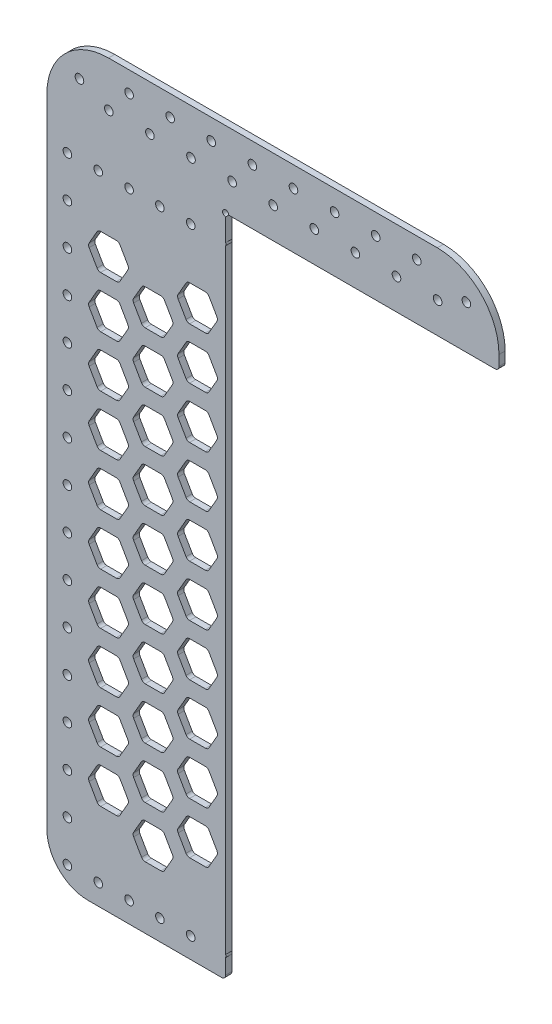
from build123d import *

# Parameters (mm, degrees)
SKETCH1_W           = 110
SKETCH1_H           = 320
BOSS_EXTRUDE1_DEPTH = 3
BOSS_EXTRUDE2_DEPTH = 3
SKETCH3_W           = 20
SKETCH3_H           = 55
SKETCH3_W_2         = 60
SKETCH3_H_2         = 190
CUT_EXTRUDE1_DEPTH  = 260.295198567
CUT_EXTRUDE2_DEPTH  = 260.295198567
FILLET1_R           = 2
FILL_PATTERN2_DEPTH = 3
SKETCH6_R           = 2.1
CUT_EXTRUDE3_DEPTH  = 260.295198567
SKETCH8_R           = 1
CUT_EXTRUDE4_DEPTH  = 260.295198567
FILLET2_R           = 5
FILLET3_R           = 10
FILLET4_R           = 20
SKETCH9_R           = 2.1
CUT_EXTRUDE5_DEPTH  = 260.295198567
SKETCH10_R          = 2.1
CUT_EXTRUDE6_DEPTH  = 260.295198567
SKETCH11_R          = 2.1
CUT_EXTRUDE7_DEPTH  = 260.295198567
SKETCH12_W          = 133
SKETCH12_H          = 323
CUT_EXTRUDE13_DEPTH = 10
SKETCH13_R          = 2.1
BOSS_EXTRUDE3_DEPTH = 3
FILLET5_R           = 2
SKETCH14_R          = 1.5
CUT_EXTRUDE14_DEPTH = 260.295198567
SKETCH15_R          = 2.1
CUT_EXTRUDE15_DEPTH = 260.295198567


# Read off the part's stored shape, not the designer's step: Fill Pattern2
with BuildPart() as part:
    # Sketch1 → Boss-Extrude1 (new body)
    with BuildSketch(Plane.XY):
        Rectangle(SKETCH1_W, SKETCH1_H)
    extrude(amount=BOSS_EXTRUDE1_DEPTH)

    # Sketch2 → Boss-Extrude2 (add)
    with BuildSketch(Plane.XY.offset(3)):
        with BuildLine():
            Line((-55, 160), (-55, 170))
            ThreePointArc((-55, 170), (-46.213203436, 191.213203436), (-25, 200))
            Line((-25, 200), (135, 200))
            ThreePointArc((135, 200), (156.213203436, 191.213203436), (165, 170))
            Line((165, 170), (165, -45))
            Line((165, -45), (55, -160))
            Line((55, -160), (55, 160))
            Line((55, 160), (-55, 160))
        make_face()
    extrude(amount=-BOSS_EXTRUDE2_DEPTH)

    # Sketch3 → Cut-Extrude1 (cut, through all)
    with BuildSketch(Plane.XY.offset(3)):
        with Locations((45, 72.508427125)):
            Rectangle(SKETCH3_W, SKETCH3_H)
        with Locations((100, 66.131519895)):
            Rectangle(SKETCH3_W_2, SKETCH3_H_2)
    extrude(amount=-CUT_EXTRUDE1_DEPTH, mode=Mode.SUBTRACT)

    # Sketch5 → Cut-Extrude2 (cut, through all)
    with BuildSketch(Plane.XY.offset(3)):
        Polygon((-20, 125), (-30, 125), (-35, 116.339745962), (-30, 107.679491924), (-20, 107.679491924), (-15, 116.339745962), align=None)
    extrude(amount=-CUT_EXTRUDE2_DEPTH, mode=Mode.SUBTRACT)

    # Fillet1
    fillet1_edges = [part.edges().sort_by_distance(p)[0] for p in [
        (-20, 125, 1.5),
        (-15, 116.339745962, 1.5),
        (-20, 107.679491924, 1.5),
        (-30, 107.679491924, 1.5),
        (-35, 116.339745962, 1.5),
        (-30, 125, 1.5),
    ]]
    fillet(fillet1_edges, radius=FILLET1_R)

    # Fill Pattern2 outline → Fill Pattern2 (cut)
    with BuildSketch(Plane.XY):
        with BuildLine():
            ThreePointArc((6.073284825, 77.839745962), (6.341234018, 78.839745962), (6.073284825, 79.839745962))
            Line((6.073284825, 79.839745962), (2.227985364, 86.5))
            ThreePointArc((2.227985364, 86.5), (1.495934556, 87.232050808), (0.495934556, 87.5))
            Line((0.495934556, 87.5), (-7.194664367, 87.5))
            ThreePointArc((-7.194664367, 87.5), (-8.194664367, 87.232050808), (-8.926715175, 86.5))
            Line((-8.926715175, 86.5), (-12.772014636, 79.839745962))
            ThreePointArc((-12.772014636, 79.839745962), (-13.039963829, 78.839745962), (-12.772014636, 77.839745962))
            Line((-12.772014636, 77.839745962), (-8.926715175, 71.179491924))
            ThreePointArc((-8.926715175, 71.179491924), (-8.194664367, 70.447441117), (-7.194664367, 70.179491924))
            Line((-7.194664367, 70.179491924), (0.495934556, 70.179491924))
            ThreePointArc((0.495934556, 70.179491924), (1.495934556, 70.447441117), (2.227985364, 71.179491924))
            Line((2.227985364, 71.179491924), (6.073284825, 77.839745962))
        make_face()
        with BuildLine():
            ThreePointArc((27.72391992, 40.339745962), (27.991869112, 41.339745962), (27.72391992, 42.339745962))
            Line((27.72391992, 42.339745962), (23.878620458, 49))
            ThreePointArc((23.878620458, 49), (23.146569651, 49.732050808), (22.146569651, 50))
            Line((22.146569651, 50), (14.455970728, 50))
            ThreePointArc((14.455970728, 50), (13.455970728, 49.732050808), (12.72391992, 49))
            Line((12.72391992, 49), (8.878620458, 42.339745962))
            ThreePointArc((8.878620458, 42.339745962), (8.610671266, 41.339745962), (8.878620458, 40.339745962))
            Line((8.878620458, 40.339745962), (12.72391992, 33.679491924))
            ThreePointArc((12.72391992, 33.679491924), (13.455970728, 32.947441117), (14.455970728, 32.679491924))
            Line((14.455970728, 32.679491924), (22.146569651, 32.679491924))
            ThreePointArc((22.146569651, 32.679491924), (23.146569651, 32.947441117), (23.878620458, 33.679491924))
            Line((23.878620458, 33.679491924), (27.72391992, 40.339745962))
        make_face()
        with BuildLine():
            ThreePointArc((12.72391992, 108.679491924), (13.455970728, 107.947441117), (14.455970728, 107.679491924))
            Line((14.455970728, 107.679491924), (22.146569651, 107.679491924))
            ThreePointArc((22.146569651, 107.679491924), (23.146569651, 107.947441117), (23.878620458, 108.679491924))
            Line((23.878620458, 108.679491924), (27.72391992, 115.339745962))
            ThreePointArc((27.72391992, 115.339745962), (27.991869112, 116.339745962), (27.72391992, 117.339745962))
            Line((27.72391992, 117.339745962), (23.878620458, 124))
            ThreePointArc((23.878620458, 124), (23.146569651, 124.732050808), (22.146569651, 125))
            Line((22.146569651, 125), (14.455970728, 125))
            ThreePointArc((14.455970728, 125), (13.455970728, 124.732050808), (12.72391992, 124))
            Line((12.72391992, 124), (8.878620458, 117.339745962))
            ThreePointArc((8.878620458, 117.339745962), (8.610671266, 116.339745962), (8.878620458, 115.339745962))
            Line((8.878620458, 115.339745962), (12.72391992, 108.679491924))
        make_face()
        with BuildLine():
            ThreePointArc((-21.154700538, 32.679491924), (-20.154700538, 32.947441117), (-19.422649731, 33.679491924))
            Line((-19.422649731, 33.679491924), (-15.577350269, 40.339745962))
            ThreePointArc((-15.577350269, 40.339745962), (-15.309401077, 41.339745962), (-15.577350269, 42.339745962))
            Line((-15.577350269, 42.339745962), (-19.422649731, 49))
            ThreePointArc((-19.422649731, 49), (-20.154700538, 49.732050808), (-21.154700538, 50))
            Line((-21.154700538, 50), (-28.845299462, 50))
            ThreePointArc((-28.845299462, 50), (-29.845299462, 49.732050808), (-30.577350269, 49))
            Line((-30.577350269, 49), (-34.422649731, 42.339745962))
            ThreePointArc((-34.422649731, 42.339745962), (-34.690598923, 41.339745962), (-34.422649731, 40.339745962))
            Line((-34.422649731, 40.339745962), (-30.577350269, 33.679491924))
            ThreePointArc((-30.577350269, 33.679491924), (-29.845299462, 32.947441117), (-28.845299462, 32.679491924))
            Line((-28.845299462, 32.679491924), (-21.154700538, 32.679491924))
        make_face()
        with BuildLine():
            ThreePointArc((27.72391992, -59.660254038), (27.991869112, -58.660254038), (27.72391992, -57.660254038))
            Line((27.72391992, -57.660254038), (23.878620458, -51))
            ThreePointArc((23.878620458, -51), (23.146569651, -50.267949192), (22.146569651, -50))
            Line((22.146569651, -50), (14.455970728, -50))
            ThreePointArc((14.455970728, -50), (13.455970728, -50.267949192), (12.72391992, -51))
            Line((12.72391992, -51), (8.878620458, -57.660254038))
            ThreePointArc((8.878620458, -57.660254038), (8.610671266, -58.660254038), (8.878620458, -59.660254038))
            Line((8.878620458, -59.660254038), (12.72391992, -66.320508076))
            ThreePointArc((12.72391992, -66.320508076), (13.455970728, -67.052558883), (14.455970728, -67.320508076))
            Line((14.455970728, -67.320508076), (22.146569651, -67.320508076))
            ThreePointArc((22.146569651, -67.320508076), (23.146569651, -67.052558883), (23.878620458, -66.320508076))
            Line((23.878620458, -66.320508076), (27.72391992, -59.660254038))
        make_face()
        with BuildLine():
            ThreePointArc((6.073284825, -22.160254038), (6.341234018, -21.160254038), (6.073284825, -20.160254038))
            Line((6.073284825, -20.160254038), (2.227985364, -13.5))
            ThreePointArc((2.227985364, -13.5), (1.495934556, -12.767949192), (0.495934556, -12.5))
            Line((0.495934556, -12.5), (-7.194664367, -12.5))
            ThreePointArc((-7.194664367, -12.5), (-8.194664367, -12.767949192), (-8.926715175, -13.5))
            Line((-8.926715175, -13.5), (-12.772014636, -20.160254038))
            ThreePointArc((-12.772014636, -20.160254038), (-13.039963829, -21.160254038), (-12.772014636, -22.160254038))
            Line((-12.772014636, -22.160254038), (-8.926715175, -28.820508076))
            ThreePointArc((-8.926715175, -28.820508076), (-8.194664367, -29.552558883), (-7.194664367, -29.820508076))
            Line((-7.194664367, -29.820508076), (0.495934556, -29.820508076))
            ThreePointArc((0.495934556, -29.820508076), (1.495934556, -29.552558883), (2.227985364, -28.820508076))
            Line((2.227985364, -28.820508076), (6.073284825, -22.160254038))
        make_face()
        with BuildLine():
            ThreePointArc((-15.577350269, 15.339745962), (-15.309401077, 16.339745962), (-15.577350269, 17.339745962))
            Line((-15.577350269, 17.339745962), (-19.422649731, 24))
            ThreePointArc((-19.422649731, 24), (-20.154700538, 24.732050808), (-21.154700538, 25))
            Line((-21.154700538, 25), (-28.845299462, 25))
            ThreePointArc((-28.845299462, 25), (-29.845299462, 24.732050808), (-30.577350269, 24))
            Line((-30.577350269, 24), (-34.422649731, 17.339745962))
            ThreePointArc((-34.422649731, 17.339745962), (-34.690598923, 16.339745962), (-34.422649731, 15.339745962))
            Line((-34.422649731, 15.339745962), (-30.577350269, 8.679491924))
            ThreePointArc((-30.577350269, 8.679491924), (-29.845299462, 7.947441117), (-28.845299462, 7.679491924))
            Line((-28.845299462, 7.679491924), (-21.154700538, 7.679491924))
            ThreePointArc((-21.154700538, 7.679491924), (-20.154700538, 7.947441117), (-19.422649731, 8.679491924))
            Line((-19.422649731, 8.679491924), (-15.577350269, 15.339745962))
        make_face()
        with BuildLine():
            ThreePointArc((0.495934556, -104.820508076), (1.495934556, -104.552558883), (2.227985364, -103.820508076))
            Line((2.227985364, -103.820508076), (6.073284825, -97.160254038))
            ThreePointArc((6.073284825, -97.160254038), (6.341234018, -96.160254038), (6.073284825, -95.160254038))
            Line((6.073284825, -95.160254038), (2.227985364, -88.5))
            ThreePointArc((2.227985364, -88.5), (1.495934556, -87.767949192), (0.495934556, -87.5))
            Line((0.495934556, -87.5), (-7.194664367, -87.5))
            ThreePointArc((-7.194664367, -87.5), (-8.194664367, -87.767949192), (-8.926715175, -88.5))
            Line((-8.926715175, -88.5), (-12.772014636, -95.160254038))
            ThreePointArc((-12.772014636, -95.160254038), (-13.039963829, -96.160254038), (-12.772014636, -97.160254038))
            Line((-12.772014636, -97.160254038), (-8.926715175, -103.820508076))
            ThreePointArc((-8.926715175, -103.820508076), (-8.194664367, -104.552558883), (-7.194664367, -104.820508076))
            Line((-7.194664367, -104.820508076), (0.495934556, -104.820508076))
        make_face()
        with BuildLine():
            ThreePointArc((-30.577350269, -66.320508076), (-29.845299462, -67.052558883), (-28.845299462, -67.320508076))
            Line((-28.845299462, -67.320508076), (-21.154700538, -67.320508076))
            ThreePointArc((-21.154700538, -67.320508076), (-20.154700538, -67.052558883), (-19.422649731, -66.320508076))
            Line((-19.422649731, -66.320508076), (-15.577350269, -59.660254038))
            ThreePointArc((-15.577350269, -59.660254038), (-15.309401077, -58.660254038), (-15.577350269, -57.660254038))
            Line((-15.577350269, -57.660254038), (-19.422649731, -51))
            ThreePointArc((-19.422649731, -51), (-20.154700538, -50.267949192), (-21.154700538, -50))
            Line((-21.154700538, -50), (-28.845299462, -50))
            ThreePointArc((-28.845299462, -50), (-29.845299462, -50.267949192), (-30.577350269, -51))
            Line((-30.577350269, -51), (-34.422649731, -57.660254038))
            ThreePointArc((-34.422649731, -57.660254038), (-34.690598923, -58.660254038), (-34.422649731, -59.660254038))
            Line((-34.422649731, -59.660254038), (-30.577350269, -66.320508076))
        make_face()
        with BuildLine():
            ThreePointArc((6.073284825, -72.160254038), (6.341234018, -71.160254038), (6.073284825, -70.160254038))
            Line((6.073284825, -70.160254038), (2.227985364, -63.5))
            ThreePointArc((2.227985364, -63.5), (1.495934556, -62.767949192), (0.495934556, -62.5))
            Line((0.495934556, -62.5), (-7.194664367, -62.5))
            ThreePointArc((-7.194664367, -62.5), (-8.194664367, -62.767949192), (-8.926715175, -63.5))
            Line((-8.926715175, -63.5), (-12.772014636, -70.160254038))
            ThreePointArc((-12.772014636, -70.160254038), (-13.039963829, -71.160254038), (-12.772014636, -72.160254038))
            Line((-12.772014636, -72.160254038), (-8.926715175, -78.820508076))
            ThreePointArc((-8.926715175, -78.820508076), (-8.194664367, -79.552558883), (-7.194664367, -79.820508076))
            Line((-7.194664367, -79.820508076), (0.495934556, -79.820508076))
            ThreePointArc((0.495934556, -79.820508076), (1.495934556, -79.552558883), (2.227985364, -78.820508076))
            Line((2.227985364, -78.820508076), (6.073284825, -72.160254038))
        make_face()
        with BuildLine():
            ThreePointArc((-15.577350269, -34.660254038), (-15.309401077, -33.660254038), (-15.577350269, -32.660254038))
            Line((-15.577350269, -32.660254038), (-19.422649731, -26))
            ThreePointArc((-19.422649731, -26), (-20.154700538, -25.267949192), (-21.154700538, -25))
            Line((-21.154700538, -25), (-28.845299462, -25))
            ThreePointArc((-28.845299462, -25), (-29.845299462, -25.267949192), (-30.577350269, -26))
            Line((-30.577350269, -26), (-34.422649731, -32.660254038))
            ThreePointArc((-34.422649731, -32.660254038), (-34.690598923, -33.660254038), (-34.422649731, -34.660254038))
            Line((-34.422649731, -34.660254038), (-30.577350269, -41.320508076))
            ThreePointArc((-30.577350269, -41.320508076), (-29.845299462, -42.052558883), (-28.845299462, -42.320508076))
            Line((-28.845299462, -42.320508076), (-21.154700538, -42.320508076))
            ThreePointArc((-21.154700538, -42.320508076), (-20.154700538, -42.052558883), (-19.422649731, -41.320508076))
            Line((-19.422649731, -41.320508076), (-15.577350269, -34.660254038))
        make_face()
        with BuildLine():
            ThreePointArc((27.72391992, -109.660254038), (27.991869112, -108.660254038), (27.72391992, -107.660254038))
            Line((27.72391992, -107.660254038), (23.878620458, -101))
            ThreePointArc((23.878620458, -101), (23.146569651, -100.267949192), (22.146569651, -100))
            Line((22.146569651, -100), (14.455970728, -100))
            ThreePointArc((14.455970728, -100), (13.455970728, -100.267949192), (12.72391992, -101))
            Line((12.72391992, -101), (8.878620458, -107.660254038))
            ThreePointArc((8.878620458, -107.660254038), (8.610671266, -108.660254038), (8.878620458, -109.660254038))
            Line((8.878620458, -109.660254038), (12.72391992, -116.320508076))
            ThreePointArc((12.72391992, -116.320508076), (13.455970728, -117.052558883), (14.455970728, -117.320508076))
            Line((14.455970728, -117.320508076), (22.146569651, -117.320508076))
            ThreePointArc((22.146569651, -117.320508076), (23.146569651, -117.052558883), (23.878620458, -116.320508076))
            Line((23.878620458, -116.320508076), (27.72391992, -109.660254038))
        make_face()
        with BuildLine():
            ThreePointArc((22.146569651, -42.320508076), (23.146569651, -42.052558883), (23.878620458, -41.320508076))
            Line((23.878620458, -41.320508076), (27.72391992, -34.660254038))
            ThreePointArc((27.72391992, -34.660254038), (27.991869112, -33.660254038), (27.72391992, -32.660254038))
            Line((27.72391992, -32.660254038), (23.878620458, -26))
            ThreePointArc((23.878620458, -26), (23.146569651, -25.267949192), (22.146569651, -25))
            Line((22.146569651, -25), (14.455970728, -25))
            ThreePointArc((14.455970728, -25), (13.455970728, -25.267949192), (12.72391992, -26))
            Line((12.72391992, -26), (8.878620458, -32.660254038))
            ThreePointArc((8.878620458, -32.660254038), (8.610671266, -33.660254038), (8.878620458, -34.660254038))
            Line((8.878620458, -34.660254038), (12.72391992, -41.320508076))
            ThreePointArc((12.72391992, -41.320508076), (13.455970728, -42.052558883), (14.455970728, -42.320508076))
            Line((14.455970728, -42.320508076), (22.146569651, -42.320508076))
        make_face()
        with BuildLine():
            ThreePointArc((-21.154700538, -117.320508076), (-20.154700538, -117.052558883), (-19.422649731, -116.320508076))
            Line((-19.422649731, -116.320508076), (-15.577350269, -109.660254038))
            ThreePointArc((-15.577350269, -109.660254038), (-15.309401077, -108.660254038), (-15.577350269, -107.660254038))
            Line((-15.577350269, -107.660254038), (-19.422649731, -101))
            ThreePointArc((-19.422649731, -101), (-20.154700538, -100.267949192), (-21.154700538, -100))
            Line((-21.154700538, -100), (-28.845299462, -100))
            ThreePointArc((-28.845299462, -100), (-29.845299462, -100.267949192), (-30.577350269, -101))
            Line((-30.577350269, -101), (-34.422649731, -107.660254038))
            ThreePointArc((-34.422649731, -107.660254038), (-34.690598923, -108.660254038), (-34.422649731, -109.660254038))
            Line((-34.422649731, -109.660254038), (-30.577350269, -116.320508076))
            ThreePointArc((-30.577350269, -116.320508076), (-29.845299462, -117.052558883), (-28.845299462, -117.320508076))
            Line((-28.845299462, -117.320508076), (-21.154700538, -117.320508076))
        make_face()
        with BuildLine():
            ThreePointArc((-15.577350269, -84.660254038), (-15.309401077, -83.660254038), (-15.577350269, -82.660254038))
            Line((-15.577350269, -82.660254038), (-19.422649731, -76))
            ThreePointArc((-19.422649731, -76), (-20.154700538, -75.267949192), (-21.154700538, -75))
            Line((-21.154700538, -75), (-28.845299462, -75))
            ThreePointArc((-28.845299462, -75), (-29.845299462, -75.267949192), (-30.577350269, -76))
            Line((-30.577350269, -76), (-34.422649731, -82.660254038))
            ThreePointArc((-34.422649731, -82.660254038), (-34.690598923, -83.660254038), (-34.422649731, -84.660254038))
            Line((-34.422649731, -84.660254038), (-30.577350269, -91.320508076))
            ThreePointArc((-30.577350269, -91.320508076), (-29.845299462, -92.052558883), (-28.845299462, -92.320508076))
            Line((-28.845299462, -92.320508076), (-21.154700538, -92.320508076))
            ThreePointArc((-21.154700538, -92.320508076), (-20.154700538, -92.052558883), (-19.422649731, -91.320508076))
            Line((-19.422649731, -91.320508076), (-15.577350269, -84.660254038))
        make_face()
        with BuildLine():
            ThreePointArc((6.073284825, -122.160254038), (6.341234018, -121.160254038), (6.073284825, -120.160254038))
            Line((6.073284825, -120.160254038), (2.227985364, -113.5))
            ThreePointArc((2.227985364, -113.5), (1.495934556, -112.767949192), (0.495934556, -112.5))
            Line((0.495934556, -112.5), (-7.194664367, -112.5))
            ThreePointArc((-7.194664367, -112.5), (-8.194664367, -112.767949192), (-8.926715175, -113.5))
            Line((-8.926715175, -113.5), (-12.772014636, -120.160254038))
            ThreePointArc((-12.772014636, -120.160254038), (-13.039963829, -121.160254038), (-12.772014636, -122.160254038))
            Line((-12.772014636, -122.160254038), (-8.926715175, -128.820508076))
            ThreePointArc((-8.926715175, -128.820508076), (-8.194664367, -129.552558883), (-7.194664367, -129.820508076))
            Line((-7.194664367, -129.820508076), (0.495934556, -129.820508076))
            ThreePointArc((0.495934556, -129.820508076), (1.495934556, -129.552558883), (2.227985364, -128.820508076))
            Line((2.227985364, -128.820508076), (6.073284825, -122.160254038))
        make_face()
        with BuildLine():
            ThreePointArc((0.495934556, -54.820508076), (1.495934556, -54.552558883), (2.227985364, -53.820508076))
            Line((2.227985364, -53.820508076), (6.073284825, -47.160254038))
            ThreePointArc((6.073284825, -47.160254038), (6.341234018, -46.160254038), (6.073284825, -45.160254038))
            Line((6.073284825, -45.160254038), (2.227985364, -38.5))
            ThreePointArc((2.227985364, -38.5), (1.495934556, -37.767949192), (0.495934556, -37.5))
            Line((0.495934556, -37.5), (-7.194664367, -37.5))
            ThreePointArc((-7.194664367, -37.5), (-8.194664367, -37.767949192), (-8.926715175, -38.5))
            Line((-8.926715175, -38.5), (-12.772014636, -45.160254038))
            ThreePointArc((-12.772014636, -45.160254038), (-13.039963829, -46.160254038), (-12.772014636, -47.160254038))
            Line((-12.772014636, -47.160254038), (-8.926715175, -53.820508076))
            ThreePointArc((-8.926715175, -53.820508076), (-8.194664367, -54.552558883), (-7.194664367, -54.820508076))
            Line((-7.194664367, -54.820508076), (0.495934556, -54.820508076))
        make_face()
        with BuildLine():
            ThreePointArc((22.146569651, -17.320508076), (23.146569651, -17.052558883), (23.878620458, -16.320508076))
            Line((23.878620458, -16.320508076), (27.72391992, -9.660254038))
            ThreePointArc((27.72391992, -9.660254038), (27.991869112, -8.660254038), (27.72391992, -7.660254038))
            Line((27.72391992, -7.660254038), (23.878620458, -1))
            ThreePointArc((23.878620458, -1), (23.146569651, -0.267949192), (22.146569651, 0))
            Line((22.146569651, 0), (14.455970728, 0))
            ThreePointArc((14.455970728, 0), (13.455970728, -0.267949192), (12.72391992, -1))
            Line((12.72391992, -1), (8.878620458, -7.660254038))
            ThreePointArc((8.878620458, -7.660254038), (8.610671266, -8.660254038), (8.878620458, -9.660254038))
            Line((8.878620458, -9.660254038), (12.72391992, -16.320508076))
            ThreePointArc((12.72391992, -16.320508076), (13.455970728, -17.052558883), (14.455970728, -17.320508076))
            Line((14.455970728, -17.320508076), (22.146569651, -17.320508076))
        make_face()
        with BuildLine():
            ThreePointArc((12.72391992, -91.320508076), (13.455970728, -92.052558883), (14.455970728, -92.320508076))
            Line((14.455970728, -92.320508076), (22.146569651, -92.320508076))
            ThreePointArc((22.146569651, -92.320508076), (23.146569651, -92.052558883), (23.878620458, -91.320508076))
            Line((23.878620458, -91.320508076), (27.72391992, -84.660254038))
            ThreePointArc((27.72391992, -84.660254038), (27.991869112, -83.660254038), (27.72391992, -82.660254038))
            Line((27.72391992, -82.660254038), (23.878620458, -76))
            ThreePointArc((23.878620458, -76), (23.146569651, -75.267949192), (22.146569651, -75))
            Line((22.146569651, -75), (14.455970728, -75))
            ThreePointArc((14.455970728, -75), (13.455970728, -75.267949192), (12.72391992, -76))
            Line((12.72391992, -76), (8.878620458, -82.660254038))
            ThreePointArc((8.878620458, -82.660254038), (8.610671266, -83.660254038), (8.878620458, -84.660254038))
            Line((8.878620458, -84.660254038), (12.72391992, -91.320508076))
        make_face()
        with BuildLine():
            ThreePointArc((-15.577350269, -9.660254038), (-15.309401077, -8.660254038), (-15.577350269, -7.660254038))
            Line((-15.577350269, -7.660254038), (-19.422649731, -1))
            ThreePointArc((-19.422649731, -1), (-20.154700538, -0.267949192), (-21.154700538, 0))
            Line((-21.154700538, 0), (-28.845299462, 0))
            ThreePointArc((-28.845299462, 0), (-29.845299462, -0.267949192), (-30.577350269, -1))
            Line((-30.577350269, -1), (-34.422649731, -7.660254038))
            ThreePointArc((-34.422649731, -7.660254038), (-34.690598923, -8.660254038), (-34.422649731, -9.660254038))
            Line((-34.422649731, -9.660254038), (-30.577350269, -16.320508076))
            ThreePointArc((-30.577350269, -16.320508076), (-29.845299462, -17.052558883), (-28.845299462, -17.320508076))
            Line((-28.845299462, -17.320508076), (-21.154700538, -17.320508076))
            ThreePointArc((-21.154700538, -17.320508076), (-20.154700538, -17.052558883), (-19.422649731, -16.320508076))
            Line((-19.422649731, -16.320508076), (-15.577350269, -9.660254038))
        make_face()
        with BuildLine():
            ThreePointArc((0.495934556, -4.820508076), (1.495934556, -4.552558883), (2.227985364, -3.820508076))
            Line((2.227985364, -3.820508076), (6.073284825, 2.839745962))
            ThreePointArc((6.073284825, 2.839745962), (6.341234018, 3.839745962), (6.073284825, 4.839745962))
            Line((6.073284825, 4.839745962), (2.227985364, 11.5))
            ThreePointArc((2.227985364, 11.5), (1.495934556, 12.232050808), (0.495934556, 12.5))
            Line((0.495934556, 12.5), (-7.194664367, 12.5))
            ThreePointArc((-7.194664367, 12.5), (-8.194664367, 12.232050808), (-8.926715175, 11.5))
            Line((-8.926715175, 11.5), (-12.772014636, 4.839745962))
            ThreePointArc((-12.772014636, 4.839745962), (-13.039963829, 3.839745962), (-12.772014636, 2.839745962))
            Line((-12.772014636, 2.839745962), (-8.926715175, -3.820508076))
            ThreePointArc((-8.926715175, -3.820508076), (-8.194664367, -4.552558883), (-7.194664367, -4.820508076))
            Line((-7.194664367, -4.820508076), (0.495934556, -4.820508076))
        make_face()
        with BuildLine():
            ThreePointArc((22.146569651, 7.679491924), (23.146569651, 7.947441117), (23.878620458, 8.679491924))
            Line((23.878620458, 8.679491924), (27.72391992, 15.339745962))
            ThreePointArc((27.72391992, 15.339745962), (27.991869112, 16.339745962), (27.72391992, 17.339745962))
            Line((27.72391992, 17.339745962), (23.878620458, 24))
            ThreePointArc((23.878620458, 24), (23.146569651, 24.732050808), (22.146569651, 25))
            Line((22.146569651, 25), (14.455970728, 25))
            ThreePointArc((14.455970728, 25), (13.455970728, 24.732050808), (12.72391992, 24))
            Line((12.72391992, 24), (8.878620458, 17.339745962))
            ThreePointArc((8.878620458, 17.339745962), (8.610671266, 16.339745962), (8.878620458, 15.339745962))
            Line((8.878620458, 15.339745962), (12.72391992, 8.679491924))
            ThreePointArc((12.72391992, 8.679491924), (13.455970728, 7.947441117), (14.455970728, 7.679491924))
            Line((14.455970728, 7.679491924), (22.146569651, 7.679491924))
        make_face()
        with BuildLine():
            ThreePointArc((-15.577350269, 65.339745962), (-15.309401077, 66.339745962), (-15.577350269, 67.339745962))
            Line((-15.577350269, 67.339745962), (-19.422649731, 74))
            ThreePointArc((-19.422649731, 74), (-20.154700538, 74.732050808), (-21.154700538, 75))
            Line((-21.154700538, 75), (-28.845299462, 75))
            ThreePointArc((-28.845299462, 75), (-29.845299462, 74.732050808), (-30.577350269, 74))
            Line((-30.577350269, 74), (-34.422649731, 67.339745962))
            ThreePointArc((-34.422649731, 67.339745962), (-34.690598923, 66.339745962), (-34.422649731, 65.339745962))
            Line((-34.422649731, 65.339745962), (-30.577350269, 58.679491924))
            ThreePointArc((-30.577350269, 58.679491924), (-29.845299462, 57.947441117), (-28.845299462, 57.679491924))
            Line((-28.845299462, 57.679491924), (-21.154700538, 57.679491924))
            ThreePointArc((-21.154700538, 57.679491924), (-20.154700538, 57.947441117), (-19.422649731, 58.679491924))
            Line((-19.422649731, 58.679491924), (-15.577350269, 65.339745962))
        make_face()
        with BuildLine():
            ThreePointArc((6.073284825, 27.839745962), (6.341234018, 28.839745962), (6.073284825, 29.839745962))
            Line((6.073284825, 29.839745962), (2.227985364, 36.5))
            ThreePointArc((2.227985364, 36.5), (1.495934556, 37.232050808), (0.495934556, 37.5))
            Line((0.495934556, 37.5), (-7.194664367, 37.5))
            ThreePointArc((-7.194664367, 37.5), (-8.194664367, 37.232050808), (-8.926715175, 36.5))
            Line((-8.926715175, 36.5), (-12.772014636, 29.839745962))
            ThreePointArc((-12.772014636, 29.839745962), (-13.039963829, 28.839745962), (-12.772014636, 27.839745962))
            Line((-12.772014636, 27.839745962), (-8.926715175, 21.179491924))
            ThreePointArc((-8.926715175, 21.179491924), (-8.194664367, 20.447441117), (-7.194664367, 20.179491924))
            Line((-7.194664367, 20.179491924), (0.495934556, 20.179491924))
            ThreePointArc((0.495934556, 20.179491924), (1.495934556, 20.447441117), (2.227985364, 21.179491924))
            Line((2.227985364, 21.179491924), (6.073284825, 27.839745962))
        make_face()
        with BuildLine():
            ThreePointArc((0.495934556, 95.179491924), (1.495934556, 95.447441117), (2.227985364, 96.179491924))
            Line((2.227985364, 96.179491924), (6.073284825, 102.839745962))
            ThreePointArc((6.073284825, 102.839745962), (6.341234018, 103.839745962), (6.073284825, 104.839745962))
            Line((6.073284825, 104.839745962), (2.227985364, 111.5))
            ThreePointArc((2.227985364, 111.5), (1.495934556, 112.232050808), (0.495934556, 112.5))
            Line((0.495934556, 112.5), (-7.194664367, 112.5))
            ThreePointArc((-7.194664367, 112.5), (-8.194664367, 112.232050808), (-8.926715175, 111.5))
            Line((-8.926715175, 111.5), (-12.772014636, 104.839745962))
            ThreePointArc((-12.772014636, 104.839745962), (-13.039963829, 103.839745962), (-12.772014636, 102.839745962))
            Line((-12.772014636, 102.839745962), (-8.926715175, 96.179491924))
            ThreePointArc((-8.926715175, 96.179491924), (-8.194664367, 95.447441117), (-7.194664367, 95.179491924))
            Line((-7.194664367, 95.179491924), (0.495934556, 95.179491924))
        make_face()
        with BuildLine():
            ThreePointArc((12.72391992, 58.679491924), (13.455970728, 57.947441117), (14.455970728, 57.679491924))
            Line((14.455970728, 57.679491924), (22.146569651, 57.679491924))
            ThreePointArc((22.146569651, 57.679491924), (23.146569651, 57.947441117), (23.878620458, 58.679491924))
            Line((23.878620458, 58.679491924), (27.72391992, 65.339745962))
            ThreePointArc((27.72391992, 65.339745962), (27.991869112, 66.339745962), (27.72391992, 67.339745962))
            Line((27.72391992, 67.339745962), (23.878620458, 74))
            ThreePointArc((23.878620458, 74), (23.146569651, 74.732050808), (22.146569651, 75))
            Line((22.146569651, 75), (14.455970728, 75))
            ThreePointArc((14.455970728, 75), (13.455970728, 74.732050808), (12.72391992, 74))
            Line((12.72391992, 74), (8.878620458, 67.339745962))
            ThreePointArc((8.878620458, 67.339745962), (8.610671266, 66.339745962), (8.878620458, 65.339745962))
            Line((8.878620458, 65.339745962), (12.72391992, 58.679491924))
        make_face()
        with BuildLine():
            ThreePointArc((6.073284825, 52.839745962), (6.341234018, 53.839745962), (6.073284825, 54.839745962))
            Line((6.073284825, 54.839745962), (2.227985364, 61.5))
            ThreePointArc((2.227985364, 61.5), (1.495934556, 62.232050808), (0.495934556, 62.5))
            Line((0.495934556, 62.5), (-7.194664367, 62.5))
            ThreePointArc((-7.194664367, 62.5), (-8.194664367, 62.232050808), (-8.926715175, 61.5))
            Line((-8.926715175, 61.5), (-12.772014636, 54.839745962))
            ThreePointArc((-12.772014636, 54.839745962), (-13.039963829, 53.839745962), (-12.772014636, 52.839745962))
            Line((-12.772014636, 52.839745962), (-8.926715175, 46.179491924))
            ThreePointArc((-8.926715175, 46.179491924), (-8.194664367, 45.447441117), (-7.194664367, 45.179491924))
            Line((-7.194664367, 45.179491924), (0.495934556, 45.179491924))
            ThreePointArc((0.495934556, 45.179491924), (1.495934556, 45.447441117), (2.227985364, 46.179491924))
            Line((2.227985364, 46.179491924), (6.073284825, 52.839745962))
        make_face()
        with BuildLine():
            ThreePointArc((-15.577350269, 90.339745962), (-15.309401077, 91.339745962), (-15.577350269, 92.339745962))
            Line((-15.577350269, 92.339745962), (-19.422649731, 99))
            ThreePointArc((-19.422649731, 99), (-20.154700538, 99.732050808), (-21.154700538, 100))
            Line((-21.154700538, 100), (-28.845299462, 100))
            ThreePointArc((-28.845299462, 100), (-29.845299462, 99.732050808), (-30.577350269, 99))
            Line((-30.577350269, 99), (-34.422649731, 92.339745962))
            ThreePointArc((-34.422649731, 92.339745962), (-34.690598923, 91.339745962), (-34.422649731, 90.339745962))
            Line((-34.422649731, 90.339745962), (-30.577350269, 83.679491924))
            ThreePointArc((-30.577350269, 83.679491924), (-29.845299462, 82.947441117), (-28.845299462, 82.679491924))
            Line((-28.845299462, 82.679491924), (-21.154700538, 82.679491924))
            ThreePointArc((-21.154700538, 82.679491924), (-20.154700538, 82.947441117), (-19.422649731, 83.679491924))
            Line((-19.422649731, 83.679491924), (-15.577350269, 90.339745962))
        make_face()
        with BuildLine():
            ThreePointArc((22.146569651, 82.679491924), (23.146569651, 82.947441117), (23.878620458, 83.679491924))
            Line((23.878620458, 83.679491924), (27.72391992, 90.339745962))
            ThreePointArc((27.72391992, 90.339745962), (27.991869112, 91.339745962), (27.72391992, 92.339745962))
            Line((27.72391992, 92.339745962), (23.878620458, 99))
            ThreePointArc((23.878620458, 99), (23.146569651, 99.732050808), (22.146569651, 100))
            Line((22.146569651, 100), (14.455970728, 100))
            ThreePointArc((14.455970728, 100), (13.455970728, 99.732050808), (12.72391992, 99))
            Line((12.72391992, 99), (8.878620458, 92.339745962))
            ThreePointArc((8.878620458, 92.339745962), (8.610671266, 91.339745962), (8.878620458, 90.339745962))
            Line((8.878620458, 90.339745962), (12.72391992, 83.679491924))
            ThreePointArc((12.72391992, 83.679491924), (13.455970728, 82.947441117), (14.455970728, 82.679491924))
            Line((14.455970728, 82.679491924), (22.146569651, 82.679491924))
        make_face()
    extrude(amount=FILL_PATTERN2_DEPTH, mode=Mode.SUBTRACT)

    # Sketch6 → Cut-Extrude3 (cut, through all)
    with BuildSketch(Plane(origin=(0, 0, 0), x_dir=(-1, 0, 0), z_dir=(0, 0, -1))):
        with Locations((-155, 161.131519895)):
            Circle(SKETCH6_R)
        with Locations((-45, 161.131519895)):
            Circle(SKETCH6_R)
        with Locations((-155, 121.131519895)):
            Circle(SKETCH6_R)
        with Locations((-45, 121.131519895)):
            Circle(SKETCH6_R)
        with Locations((-155, 81.131519895)):
            Circle(SKETCH6_R)
        with Locations((-155, 41.131519895)):
            Circle(SKETCH6_R)
        with Locations((-155, 1.131519895)):
            Circle(SKETCH6_R)
        with Locations((-45, 1.131519895)):
            Circle(SKETCH6_R)
        with Locations((-155, -38.868480105)):
            Circle(SKETCH6_R)
        with Locations((-45, -38.868480105)):
            Circle(SKETCH6_R)
        with Locations((-45, -78.868480105)):
            Circle(SKETCH6_R)
        with Locations((-45, -118.868480105)):
            Circle(SKETCH6_R)
    extrude(amount=-CUT_EXTRUDE3_DEPTH, mode=Mode.SUBTRACT)

    # Sketch8 → Cut-Extrude4 (cut, through all)
    with BuildSketch(Plane(origin=(0, 0, 0), x_dir=(-1, 0, 0), z_dir=(0, 0, -1))):
        with Locations((-35, 100.008427125)):
            Circle(SKETCH8_R)
        with Locations((-35, 45.008427125)):
            Circle(SKETCH8_R)
    extrude(amount=-CUT_EXTRUDE4_DEPTH, mode=Mode.SUBTRACT)

    # Fillet2
    fillet2_edges = [part.edges().sort_by_distance(p)[0] for p in [
        (55, 100.008427125, 1.5),
        (55, 45.008427125, 1.5),
    ]]
    fillet(fillet2_edges, radius=FILLET2_R)

    # Fillet3
    fillet3_edges = [part.edges().sort_by_distance(p)[0] for p in [
        (70, -28.868480105, 1.5),
        (70, 161.131519895, 1.5),
        (130, 161.131519895, 1.5),
        (130, -28.868480105, 1.5),
    ]]
    fillet(fillet3_edges, radius=FILLET3_R)

    # Fillet4
    fillet4_edges = [part.edges().sort_by_distance(p)[0] for p in [
        (165, -45, 1.5),
        (-55, -160, 1.5),
        (55, -160, 1.5),
    ]]
    fillet(fillet4_edges, radius=FILLET4_R)

    # Sketch9 → Cut-Extrude5 (cut, through all)
    with BuildSketch(Plane(origin=(0, 0, 0), x_dir=(-1, 0, 0), z_dir=(0, 0, -1))):
        with Locations((45, 150)):
            Circle(SKETCH9_R)
        with Locations((30, 150)):
            Circle(SKETCH9_R)
        with Locations((15, 150)):
            Circle(SKETCH9_R)
        with Locations((0, 150)):
            Circle(SKETCH9_R)
        with Locations((-15, 150)):
            Circle(SKETCH9_R)
        with Locations((45, -150)):
            Circle(SKETCH9_R)
        with Locations((-30, 150)):
            Circle(SKETCH9_R)
        with Locations((-45, 150)):
            Circle(SKETCH9_R)
        with Locations((30, -150)):
            Circle(SKETCH9_R)
        with Locations((15, -150)):
            Circle(SKETCH9_R)
        with Locations((0, -150)):
            Circle(SKETCH9_R)
        with Locations((-15, -150)):
            Circle(SKETCH9_R)
        with Locations((-30, -150)):
            Circle(SKETCH9_R)
        with Locations((-45, -150)):
            Circle(SKETCH9_R)
    extrude(amount=-CUT_EXTRUDE5_DEPTH, mode=Mode.SUBTRACT)

    # Sketch10 → Cut-Extrude6 (cut, through all)
    with BuildSketch(Plane(origin=(0, 0, 0), x_dir=(-1, 0, 0), z_dir=(0, 0, -1))):
        with Locations((45, -130)):
            Circle(SKETCH10_R)
        with Locations((45, -110)):
            Circle(SKETCH10_R)
        with Locations((45, -90)):
            Circle(SKETCH10_R)
        with Locations((45, -70)):
            Circle(SKETCH10_R)
        with Locations((45, -50)):
            Circle(SKETCH10_R)
        with Locations((45, -30)):
            Circle(SKETCH10_R)
        with Locations((45, -10)):
            Circle(SKETCH10_R)
        with Locations((45, 10)):
            Circle(SKETCH10_R)
        with Locations((45, 30)):
            Circle(SKETCH10_R)
        with Locations((45, 50)):
            Circle(SKETCH10_R)
        with Locations((45, 70)):
            Circle(SKETCH10_R)
        with Locations((45, 90)):
            Circle(SKETCH10_R)
        with Locations((45, 110)):
            Circle(SKETCH10_R)
        with Locations((45, 130)):
            Circle(SKETCH10_R)
    extrude(amount=-CUT_EXTRUDE6_DEPTH, mode=Mode.SUBTRACT)

    # Sketch11 → Cut-Extrude7 (cut, through all)
    with BuildSketch(Plane.XY.offset(3)):
        with Locations((-39.142135624, 184.142135624)):
            Circle(SKETCH11_R)
        with Locations((-15, 190)):
            Circle(SKETCH11_R)
        with Locations((25, 190)):
            Circle(SKETCH11_R)
        with Locations((45, 190)):
            Circle(SKETCH11_R)
        with Locations((5, 190)):
            Circle(SKETCH11_R)
        with Locations((65, 190)):
            Circle(SKETCH11_R)
        with Locations((85, 190)):
            Circle(SKETCH11_R)
        with Locations((105, 190)):
            Circle(SKETCH11_R)
        with Locations((125, 190)):
            Circle(SKETCH11_R)
        with Locations((149.142135624, 184.142135624)):
            Circle(SKETCH11_R)
        with Locations(Location((155, 161.131519895, 0), (0, 0, 180))):
            Circle(SKETCH11_R)
    extrude(amount=-CUT_EXTRUDE7_DEPTH, mode=Mode.SUBTRACT)

    # Sketch12 → Cut-Extrude13 (cut)
    with BuildSketch(Plane.XY):
        with Locations((98.5, 1.5)):
            Rectangle(SKETCH12_W, SKETCH12_H)
    extrude(amount=CUT_EXTRUDE13_DEPTH, mode=Mode.SUBTRACT)

    # Sketch13 → Boss-Extrude3 (add)
    with BuildSketch(Plane(origin=(0, 0, 0), x_dir=(-1, 0, 0), z_dir=(0, 0, -1))):
        with Locations((-30, 150)):
            Circle(SKETCH13_R)
        with Locations((-30, -150)):
            Circle(SKETCH13_R)
        with BuildLine():
            Line((-44.041468781, 163), (-45.958531219, 163))
            ThreePointArc((-45.958531219, 163), (-45, 163.231519895), (-44.041468781, 163))
        make_face()
        with BuildLine():
            Line((-155.958531219, 163), (-154.041468781, 163))
            ThreePointArc((-154.041468781, 163), (-155, 163.231519895), (-155.958531219, 163))
        make_face()
    extrude(amount=-BOSS_EXTRUDE3_DEPTH)

    # Fillet5
    fillet5_edges = [part.edges().sort_by_distance(p)[0] for p in [
        (165, 163, 1.5),
        (32, -160, 1.5),
    ]]
    fillet(fillet5_edges, radius=FILLET5_R)

    # Sketch14 → Cut-Extrude14 (cut, through all)
    with BuildSketch(Plane(origin=(0, 0, 0), x_dir=(-1, 0, 0), z_dir=(0, 0, -1))):
        with Locations((-32, 163)):
            Circle(SKETCH14_R)
    extrude(amount=-CUT_EXTRUDE14_DEPTH, mode=Mode.SUBTRACT)

    # Sketch15 → Cut-Extrude15 (cut, through all)
    with BuildSketch(Plane(origin=(0, 0, 0), x_dir=(-1, 0, 0), z_dir=(0, 0, -1))):
        with Locations((-115.139062465, 178)):
            Circle(SKETCH15_R)
        with Locations((-135.139062465, 178)):
            Circle(SKETCH15_R)
        with Locations((-95.139062465, 178)):
            Circle(SKETCH15_R)
        with Locations((-75.139062465, 178)):
            Circle(SKETCH15_R)
        with Locations((-55.139062465, 178)):
            Circle(SKETCH15_R)
        with Locations((-35.139062465, 178)):
            Circle(SKETCH15_R)
        with Locations((-15.139062465, 178)):
            Circle(SKETCH15_R)
        with Locations((4.860937535, 178)):
            Circle(SKETCH15_R)
        with Locations((24.860937535, 178)):
            Circle(SKETCH15_R)
    extrude(amount=-CUT_EXTRUDE15_DEPTH, mode=Mode.SUBTRACT)


solid = part.part
